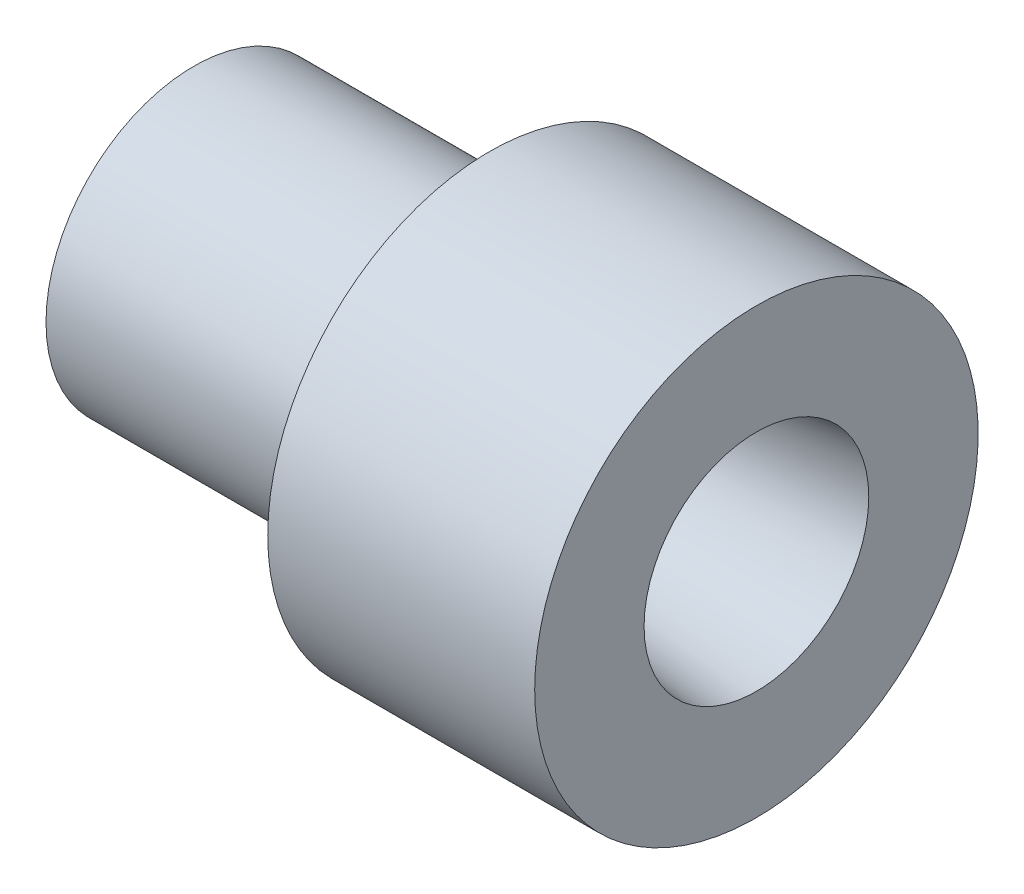
from build123d import *


with BuildPart() as part:
    # Sketch1 → Revolve1 (revolve)
    with BuildSketch(Plane(origin=(0, 0, 0), x_dir=(1, 0, 0), z_dir=(0, 1, 0))):
        Polygon((0, 2.286), (0, 6.35), (12.7, 6.35), (12.7, 9.525), (24.166485714, 9.525), (24.166485714, 4.826), align=None)
    revolve(axis=Axis((0, 0, 0), (1, 0, 0)))


solid = part.part
